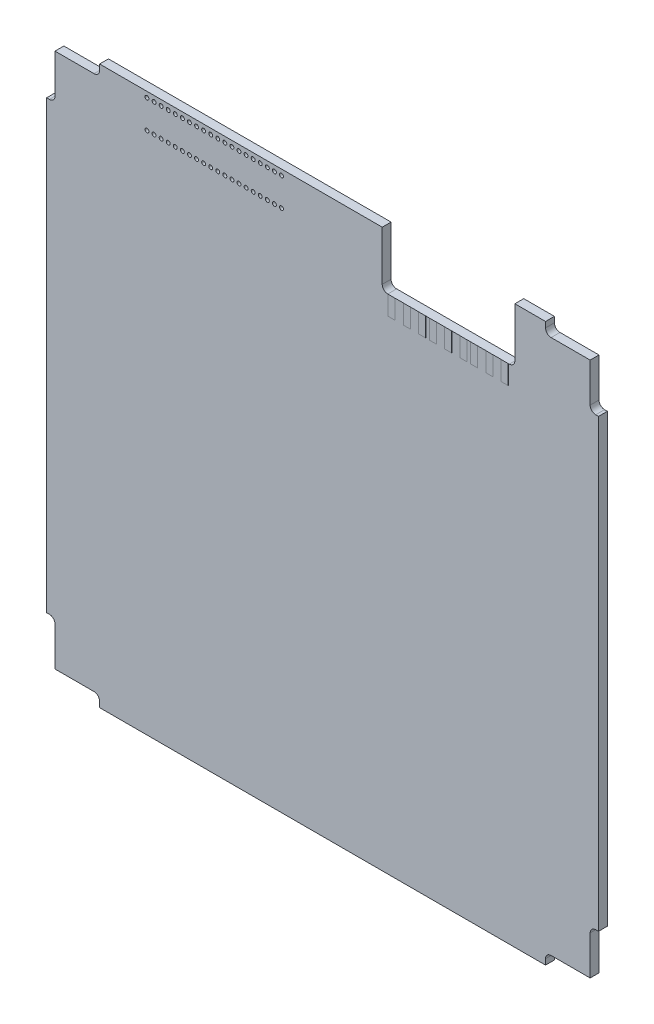
from build123d import *

# Parameters (mm, degrees)
BOSS_EXTRUDE1_DEPTH = 1.5875
FILLET1_R           = 1
SKETCH2_R           = 0.35
CUT_EXTRUDE1_DEPTH  = 71.728496069
CUT_EXTRUDE2_DEPTH  = 9.8806
FILLET2_R           = 1
SKETCH5_OUTSIDE_W   = 130.286
SKETCH5_OUTSIDE_H   = 130.286
SKETCH5_OUTSIDE_W_2 = 99
SKETCH5_OUTSIDE_H_2 = 100
CUT_EXTRUDE3_DEPTH  = 71.728496069
SKETCH6_W           = 1.27
SKETCH6_H           = 3.43
BOSS_EXTRUDE2_DEPTH = 0.01


with BuildPart() as part:
    # Sketch1 → Boss-Extrude1 (new body)
    with BuildSketch(Plane.XY):
        Polygon((40, 50), (-40, 50), (-40, 48), (-48, 48), (-48, 40), (-50, 40), (-50, -37.864895224), (-50, -40), (-48, -40), (-48, -48), (-40, -48), (-40, -50), (-37.864895224, -50), (40, -50), (40, -48), (48, -48), (48, -40), (50, -40), (50, 40), (48, 40), (48, 48), (40, 48), align=None)
    extrude(amount=BOSS_EXTRUDE1_DEPTH)

    # Fillet1
    fillet1_edges = [part.edges().sort_by_distance(p)[0] for p in [
        (-48, -40, 0.79375),
        (-40, -48, 0.79375),
        (40, -48, 0.79375),
        (48, -40, 0.79375),
        (48, 40, 0.79375),
        (40, 48, 0.79375),
        (-40, 48, 0.79375),
        (-48, 40, 0.79375),
    ]]
    fillet(fillet1_edges, radius=FILLET1_R)

    # Sketch2 → Cut-Extrude1 (cut, through all)
    with BuildSketch(Plane.XY.offset(1.5875)):
        with Locations((-31.5, 49)):
            Circle(SKETCH2_R)
        with Locations((-30.23, 49)):
            Circle(SKETCH2_R)
        with Locations((-28.96, 49)):
            Circle(SKETCH2_R)
        with Locations((-27.69, 49)):
            Circle(SKETCH2_R)
        with Locations((-26.42, 49)):
            Circle(SKETCH2_R)
        with Locations((-25.15, 49)):
            Circle(SKETCH2_R)
        with Locations((-23.88, 49)):
            Circle(SKETCH2_R)
        with Locations((-22.61, 49)):
            Circle(SKETCH2_R)
        with Locations((-21.34, 49)):
            Circle(SKETCH2_R)
        with Locations((-20.07, 49)):
            Circle(SKETCH2_R)
        with Locations((-18.8, 49)):
            Circle(SKETCH2_R)
        with Locations((-17.53, 49)):
            Circle(SKETCH2_R)
        with Locations((-16.26, 49)):
            Circle(SKETCH2_R)
        with Locations((-14.99, 49)):
            Circle(SKETCH2_R)
        with Locations((-13.72, 49)):
            Circle(SKETCH2_R)
        with Locations((-12.45, 49)):
            Circle(SKETCH2_R)
        with Locations((-11.18, 49)):
            Circle(SKETCH2_R)
        with Locations((-9.91, 49)):
            Circle(SKETCH2_R)
        with Locations((-8.64, 49)):
            Circle(SKETCH2_R)
        with Locations((-7.37, 49)):
            Circle(SKETCH2_R)
        with Locations((-30.23, 43.92)):
            Circle(SKETCH2_R)
        with Locations((-28.96, 43.92)):
            Circle(SKETCH2_R)
        with Locations((-27.69, 43.92)):
            Circle(SKETCH2_R)
        with Locations((-26.42, 43.92)):
            Circle(SKETCH2_R)
        with Locations((-25.15, 43.92)):
            Circle(SKETCH2_R)
        with Locations((-23.88, 43.92)):
            Circle(SKETCH2_R)
        with Locations((-22.61, 43.92)):
            Circle(SKETCH2_R)
        with Locations((-21.34, 43.92)):
            Circle(SKETCH2_R)
        with Locations((-20.07, 43.92)):
            Circle(SKETCH2_R)
        with Locations((-18.8, 43.92)):
            Circle(SKETCH2_R)
        with Locations((-17.53, 43.92)):
            Circle(SKETCH2_R)
        with Locations((-16.26, 43.92)):
            Circle(SKETCH2_R)
        with Locations((-14.99, 43.92)):
            Circle(SKETCH2_R)
        with Locations((-13.72, 43.92)):
            Circle(SKETCH2_R)
        with Locations((-12.45, 43.92)):
            Circle(SKETCH2_R)
        with Locations((-11.18, 43.92)):
            Circle(SKETCH2_R)
        with Locations((-9.91, 43.92)):
            Circle(SKETCH2_R)
        with Locations((-8.64, 43.92)):
            Circle(SKETCH2_R)
        with Locations((-7.37, 43.92)):
            Circle(SKETCH2_R)
        with Locations((-31.5, 43.92)):
            Circle(SKETCH2_R)
    extrude(amount=-CUT_EXTRUDE1_DEPTH, mode=Mode.SUBTRACT)

    # Sketch3 → Cut-Extrude2 (cut)
    with BuildSketch(Plane(origin=(0, 50, 0), x_dir=(1, 0, 0), z_dir=(0, 1, 0))):
        Polygon((10.7, 0), (19.7, 0), (34.5, 0), (34.5, -1.5875), (19.7, -1.5875), (10.7, -1.5875), align=None)
    extrude(amount=-CUT_EXTRUDE2_DEPTH, mode=Mode.SUBTRACT)

    # Fillet2
    fillet2_edges = [part.edges().sort_by_distance(p)[0] for p in [
        (10.7, 40.1194, 0.79375),
        (34.5, 40.1194, 0.79375),
    ]]
    fillet(fillet2_edges, radius=FILLET2_R)

    # Sketch5 outside → Cut-Extrude3 (cut, through all)
    with BuildSketch(Plane(origin=(0, 0, 0), x_dir=(-1, 0, 0), z_dir=(0, 0, -1))):
        Rectangle(SKETCH5_OUTSIDE_W, SKETCH5_OUTSIDE_H)
        Rectangle(SKETCH5_OUTSIDE_W_2, SKETCH5_OUTSIDE_H_2, mode=Mode.SUBTRACT)
    extrude(amount=-CUT_EXTRUDE3_DEPTH, mode=Mode.SUBTRACT)

    # Sketch6 → Boss-Extrude2 (add)
    with BuildSketch(Plane.XY.offset(1.5875)):
        with Locations((12.4, 38.4044)):
            Rectangle(SKETCH6_W, SKETCH6_H)
        with Locations((15.14, 38.4044)):
            Rectangle(SKETCH6_W, SKETCH6_H)
        with Locations((17.88, 38.4044)):
            Rectangle(SKETCH6_W, SKETCH6_H)
        with Locations((19.8, 38.4044)):
            Rectangle(SKETCH6_W, SKETCH6_H)
        with Locations((22.54, 38.4044)):
            Rectangle(SKETCH6_W, SKETCH6_H)
        with Locations((25.28, 38.4044)):
            Rectangle(SKETCH6_W, SKETCH6_H)
        with Locations((27.2, 38.4044)):
            Rectangle(SKETCH6_W, SKETCH6_H)
        with Locations((29.94, 38.4044)):
            Rectangle(SKETCH6_W, SKETCH6_H)
        with Locations((32.68, 38.4044)):
            Rectangle(SKETCH6_W, SKETCH6_H)
    extrude(amount=BOSS_EXTRUDE2_DEPTH)


solid = part.part
